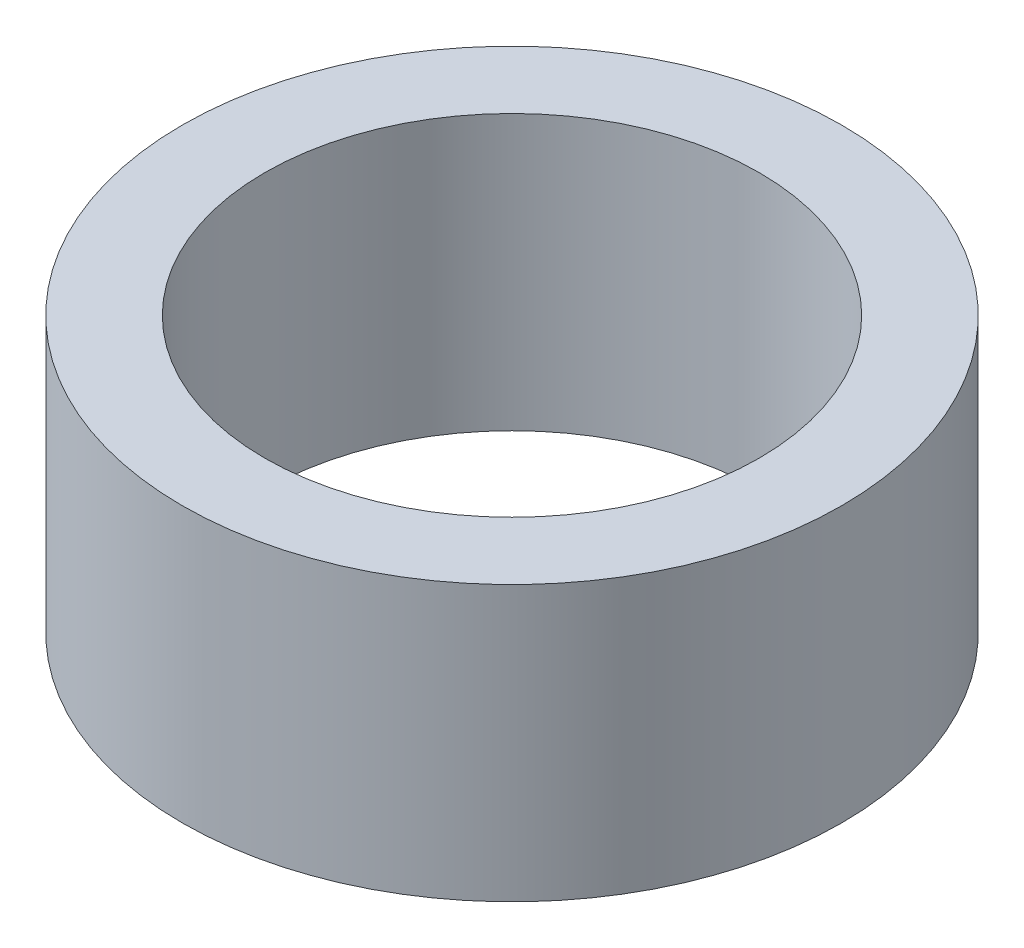
from build123d import *

# Parameters (mm, degrees)
ESQUISSE1_R        = 3
ESQUISSE1_R_2      = 2.25
BOSS_EXTRU_1_DEPTH = 2.5


with BuildPart() as part:
    # Esquisse1 → Boss.-Extru.1 (new body)
    with BuildSketch(Plane(origin=(0, 0, 0), x_dir=(1, 0, 0), z_dir=(0, 1, 0))):
        Circle(ESQUISSE1_R)
        Circle(ESQUISSE1_R_2, mode=Mode.SUBTRACT)
    extrude(amount=BOSS_EXTRU_1_DEPTH)


solid = part.part
